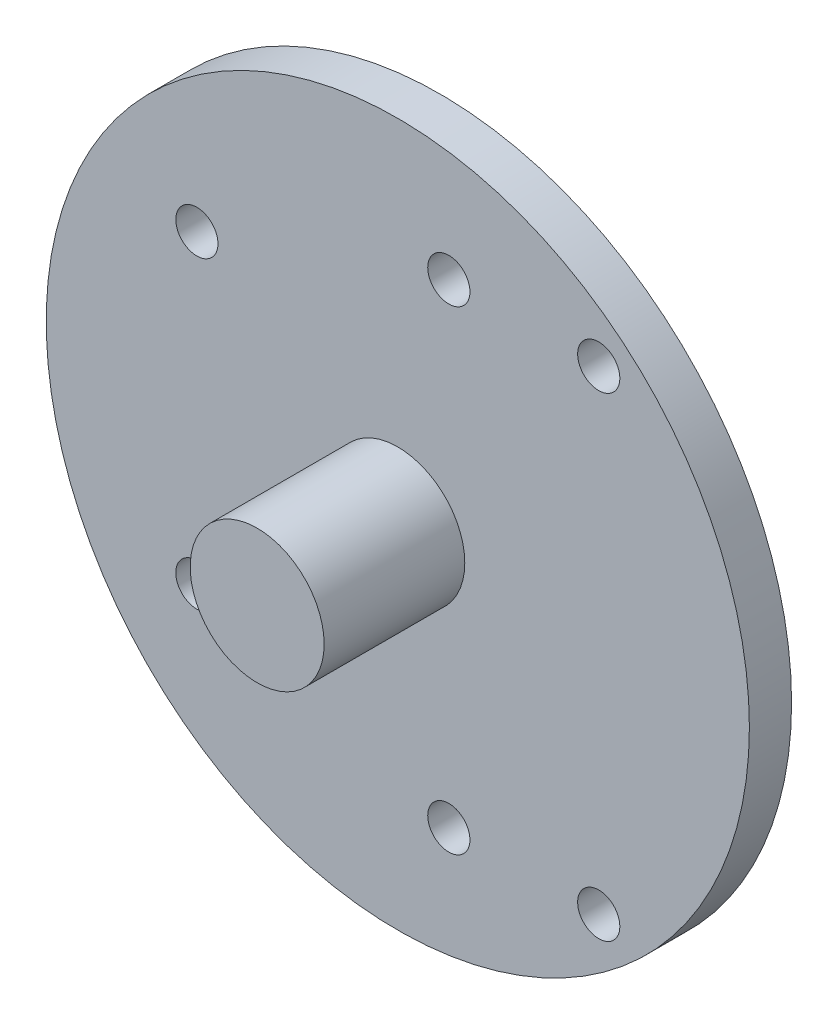
from build123d import *

# Parameters (mm, degrees)
SKETCH1_R          = 25
EXTRUDE1_DEPTH     = 3
SKETCH2_R          = 4.7625
EXTRUDE2_DEPTH     = 10
SKETCH3_R          = 1.5
CUT_EXTRUDE1_DEPTH = 38.669616404


with BuildPart() as part:
    # Sketch1 → Extrude1 (new body)
    with BuildSketch(Plane.XY):
        Circle(SKETCH1_R)
    extrude(amount=EXTRUDE1_DEPTH)

    # Sketch2 → Extrude2 (add)
    with BuildSketch(Plane.XY.offset(3)):
        Circle(SKETCH2_R)
    extrude(amount=EXTRUDE2_DEPTH)

    # Sketch3 → Cut-Extrude1 (cut, through all)
    with BuildSketch(Plane(origin=(0, 0, 0), x_dir=(-1, 0, 0), z_dir=(0, 0, -1))):
        with Locations((-14.2875, 16.875)):
            Circle(SKETCH3_R)
        with Locations((14.2875, 10.875)):
            Circle(SKETCH3_R)
        with Locations((14.2875, -10.875)):
            Circle(SKETCH3_R)
        with Locations((-14.2875, -16.875)):
            Circle(SKETCH3_R)
        with Locations((-3.6275, 16.875)):
            Circle(SKETCH3_R)
        with Locations((-3.6275, -16.875)):
            Circle(SKETCH3_R)
    extrude(amount=-CUT_EXTRUDE1_DEPTH, mode=Mode.SUBTRACT)


solid = part.part
